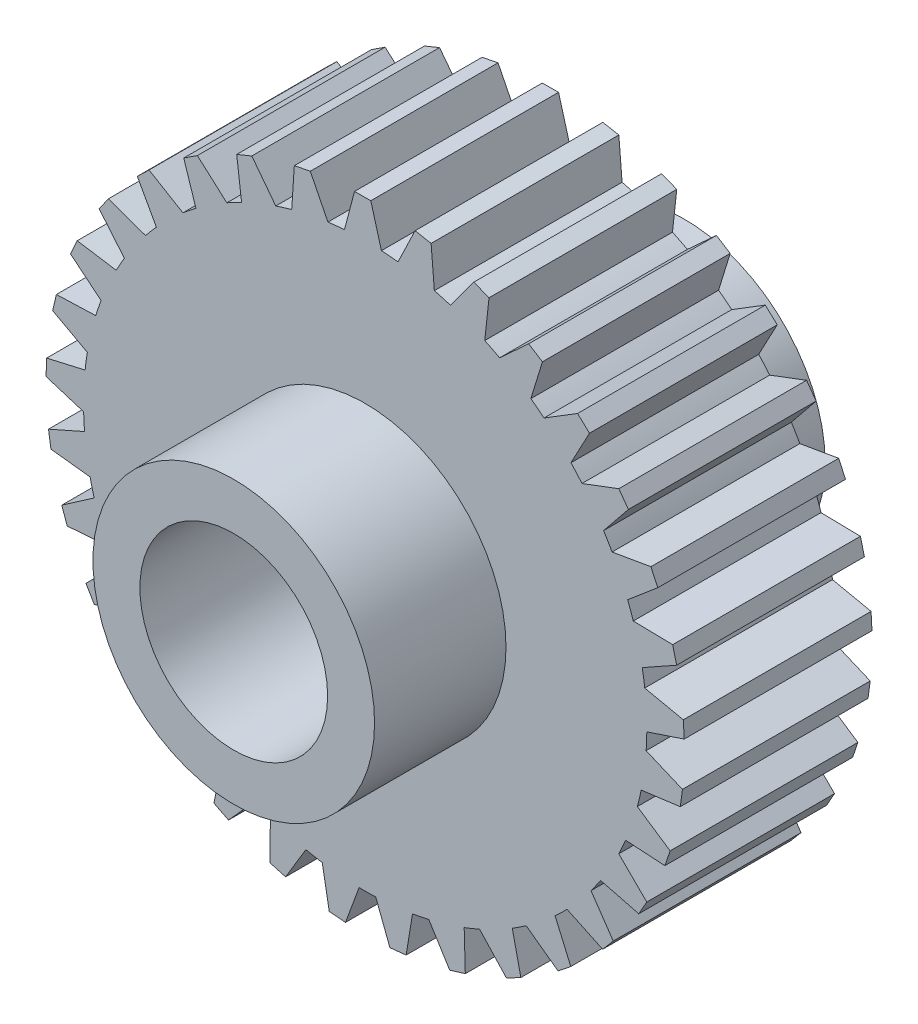
from build123d import *

# Parameters (mm, degrees)
BOSS_EXTRUDE1_DEPTH     = 5
SKETCH2_R               = 7.5
BOSS_EXTRUDE2_DEPTH     = 7
CUT_EXTRUDE1_DEPTH      = 34.968406825
CUT_EXTRUDE1_DEPTH_BACK = 34.968406825
SKETCH3_R               = 5


with BuildPart() as part:
    # Sketch1 → Boss-Extrude1 (new, symmetric)
    with BuildSketch(Plane.XY):
        with BuildLine():
            Line((-0.56896822, 16.990476013), (-1.102638188, 14.959418071))
            ThreePointArc((-1.102638188, 14.959418071), (-1.544192393, 14.920303946), (-1.984398002, 14.868159421))
            Line((-1.984398002, 14.868159421), (-2.92271381, 16.746872663))
            Line((-2.92271381, 16.746872663), (-3.774154951, 16.575758034))
            Line((-3.774154951, 16.575758034), (-3.913800564, 14.480406249))
            ThreePointArc((-3.913800564, 14.480406249), (-4.339972912, 14.358434285), (-4.762355017, 14.22392262))
            Line((-4.762355017, 14.22392262), (-6.039263054, 15.891107632))
            Line((-6.039263054, 15.891107632), (-6.842933888, 15.561948972))
            Line((-6.842933888, 15.561948972), (-6.583507991, 13.478034817))
            ThreePointArc((-6.583507991, 13.478034817), (-6.978895504, 13.277613398), (-7.368188113, 13.065596195))
            Line((-7.368188113, 13.065596195), (-8.937537597, 14.460996567))
            Line((-8.937537597, 14.460996567), (-9.664391366, 13.985690527))
            Line((-9.664391366, 13.985690527), (-9.015270286, 11.98853209))
            ThreePointArc((-9.015270286, 11.98853209), (-9.365582628, 11.716904968), (-9.707715693, 11.435045082))
            Line((-9.707715693, 11.435045082), (-11.512786244, 12.508227408))
            Line((-11.512786244, 12.508227408), (-12.136552559, 11.903952788))
            Line((-12.136552559, 11.903952788), (-11.121197223, 10.065732577))
            ThreePointArc((-11.121197223, 10.065732577), (-11.413773194, 9.732717065), (-11.696381135, 9.391201645))
            Line((-11.696381135, 9.391201645), (-13.6719328, 10.103378321))
            Line((-13.6719328, 10.103378321), (-14.170067122, 9.391975179))
            Line((-14.170067122, 9.391975179), (-12.825175117, 7.779131264))
            ThreePointArc((-12.825175117, 7.779131264), (-13.049440259, 7.396763409), (-13.262308888, 7.007935713))
            Line((-13.262308888, 7.007935713), (-15.336940083, 7.333366818))
            Line((-15.336940083, 7.333366818), (-15.691438539, 6.540547117))
            Line((-15.691438539, 6.540547117), (-14.065617767, 5.211371877))
            ThreePointArc((-14.065617767, 5.211371877), (-14.213466553, 4.793471451), (-14.348902243, 4.371384725))
            Line((-14.348902243, 4.371384725), (-16.447630392, 4.29830833))
            Line((-16.447630392, 4.29830833), (-16.645680483, 3.45272664))
            Line((-16.645680483, 3.45272664), (-14.797692342, 2.455259933))
            ThreePointArc((-14.797692342, 2.455259933), (-14.863781133, 2.016930945), (-14.916888886, 1.576840503))
            Line((-14.916888886, 1.576840503), (-16.963860484, 1.107897781))
            Line((-16.963860484, 1.107897781), (-16.998304165, 0.240115627))
            Line((-16.998304165, 0.240115627), (-14.994939762, -0.389591502))
            ThreePointArc((-14.994939762, -0.389591502), (-14.976879935, -0.8325067), (-14.945740298, -1.274694842))
            Line((-14.945740298, -1.274694842), (-16.866972459, -2.122555081))
            Line((-16.866972459, -2.122555081), (-16.736564846, -2.98117379))
            Line((-16.736564846, -2.98117379), (-14.650230989, -3.220362085))
            ThreePointArc((-14.650230989, -3.220362085), (-14.548675275, -3.651855384), (-14.434413716, -4.080159395))
            Line((-14.434413716, -4.080159395), (-16.160468103, -5.276293272))
            Line((-16.160468103, -5.276293272), (-15.869922466, -6.094715819))
            Line((-15.869922466, -6.094715819), (-13.776024698, -5.934740391))
            ThreePointArc((-13.776024698, -5.934740391), (-13.594643584, -6.339216499), (-13.401389813, -6.738156357))
            Line((-13.401389813, -6.738156357), (-14.869882324, -8.239332477))
            Line((-14.869882324, -8.239332477), (-14.42969974, -8.987978939))
            Line((-14.42969974, -8.987978939), (-12.403916981, -8.434621718))
            ThreePointArc((-12.403916981, -8.434621718), (-12.149266054, -8.797461813), (-11.884004765, -9.152618792))
            Line((-11.884004765, -9.152618792), (-13.041860255, -10.904580739))
            Line((-13.041860255, -10.904580739), (-12.467950069, -11.556393082))
            Line((-12.467950069, -11.556393082), (-10.583499387, -10.629653839))
            ThreePointArc((-10.583499387, -10.629653839), (-10.264782393, -10.937743936), (-9.937100822, -11.236281736))
            Line((-9.937100822, -11.236281736), (-10.742471376, -13.175709041))
            Line((-10.742471376, -13.175709041), (-10.055576198, -13.70712907))
            Line((-10.055576198, -13.70712907), (-8.380566549, -12.440502575))
            ThreePointArc((-8.380566549, -12.440502575), (-8.009302753, -12.682707496), (-7.631044164, -12.913836183))
            Line((-7.631044164, -12.913836183), (-8.054821592, -14.97063289))
            Line((-8.054821592, -14.97063289), (-7.279767603, -15.362453699))
            Line((-7.279767603, -15.362453699), (-5.874738201, -13.801719134))
            ThreePointArc((-5.874738201, -13.801719134), (-5.464346042, -13.969284961), (-5.049181687, -14.124650944))
            Line((-5.049181687, -14.124650944), (-5.07604957, -16.22447906))
            Line((-5.07604957, -16.22447906), (-4.24084924, -16.462539225))
            Line((-4.24084924, -16.462539225), (-3.156581508, -14.664105605))
            ThreePointArc((-3.156581508, -14.664105605), (-2.721893629, -14.750976072), (-2.284828629, -14.824964018))
            Line((-2.284828629, -14.824964018), (-1.91381589, -16.891930285))
            Line((-1.91381589, -16.891930285), (-1.048655536, -16.96762569))
            Line((-1.048655536, -16.96762569), (-0.324337735, -14.996493091))
            ThreePointArc((-0.324337735, -14.996493091), (0.118935112, -14.999528474), (0.562104089, -14.989464266))
            Line((0.562104089, -14.989464266), (1.317588082, -16.948863137))
            Line((1.317588082, -16.948863137), (2.181439312, -16.859457955))
            Line((2.181439312, -16.859457955), (2.519628449, -14.786868244))
            ThreePointArc((2.519628449, -14.786868244), (2.955465228, -14.705958836), (3.3887209, -14.612206222))
            Line((3.3887209, -14.612206222), (4.501370988, -16.393219916))
            Line((4.501370988, -16.393219916), (5.332691259, -16.141945482))
            Line((5.332691259, -16.141945482), (5.272528696, -14.042807453))
            ThreePointArc((5.272528696, -14.042807453), (5.68517713, -13.88087753), (6.092860509, -13.706824972))
            Line((6.092860509, -13.706824972), (7.522462619, -15.245083015))
            Line((7.522462619, -15.245083015), (8.291205849, -14.841021042))
            Line((8.291205849, -14.841021042), (7.834866018, -12.791203011))
            ThreePointArc((7.834866018, -12.791203011), (8.209411919, -12.554105143), (8.576788264, -12.306043355))
            Line((8.576788264, -12.306043355), (10.271672851, -13.545949094))
            Line((10.271672851, -13.545949094), (10.950054658, -13.003703433))
            Line((10.950054658, -13.003703433), (10.114030869, -11.077291166))
            ThreePointArc((10.114030869, -11.077291166), (10.436937171, -10.773594688), (10.750728545, -10.460489269))
            Line((10.750728545, -10.460489269), (12.649638063, -11.357229278))
            Line((12.649638063, -11.357229278), (13.213139961, -10.696398102))
            Line((13.213139961, -10.696398102), (12.027648293, -8.963017156))
            ThreePointArc((12.027648293, -8.963017156), (12.28724432, -8.60369845), (12.536109486, -8.236865845))
            Line((12.536109486, -8.236865845), (14.570412397, -8.758029606))
            Line((14.570412397, -8.758029606), (14.99866796, -8.002497074))
            Line((14.99866796, -8.002497074), (13.506555169, -6.524796354))
            ThreePointArc((13.506555169, -6.524796354), (13.693458446, -6.122842133), (13.868402767, -5.715540629))
            Line((13.868402767, -5.715540629), (15.964574065, -5.842291924))
            Line((15.964574065, -5.842291924), (16.24210502, -5.019364952))
            Line((16.24210502, -5.019364952), (14.497299951, -3.85075241))
            ThreePointArc((14.497299951, -3.85075241), (14.604755306, -3.420690349), (14.699455839, -2.987640883))
            Line((14.699455839, -2.987640883), (16.78173443, -2.715398591))
            Line((16.78173443, -2.715398591), (16.898510086, -1.854819902))
            Line((16.898510086, -1.854819902), (14.96407454, -1.037532242))
            ThreePointArc((14.96407454, -1.037532242), (14.988198256, -0.594905903), (14.999232277, -0.151760012))
            Line((14.999232277, -0.151760012), (16.992359189, 0.509636323))
            Line((16.992359189, 0.509636323), (16.944158969, 1.376763172))
            Line((16.944158969, 1.376763172), (14.890008487, 1.813187044))
            ThreePointArc((14.890008487, 1.813187044), (14.82992867, 2.252379993), (14.756897381, 2.689605862))
            Line((14.756897381, 2.689605862), (16.588835814, 3.716251652))
            Line((16.588835814, 3.716251652), (16.377401799, 4.558586437))
            Line((16.377401799, 4.558586437), (14.277778731, 4.598373027))
            ThreePointArc((14.277778731, 4.598373027), (14.135666823, 5.018259007), (13.981209764, 5.433762373))
            Line((13.981209764, 5.433762373), (15.58574869, 6.788551963))
            Line((15.58574869, 6.788551963), (15.218722658, 7.575650511))
            Line((15.218722658, 7.575650511), (13.149512852, 7.217361828))
            ThreePointArc((13.149512852, 7.217361828), (12.930505147, 7.602765065), (12.7002048, 7.981528553))
            Line((12.7002048, 7.981528553), (14.019352001, 9.61549632))
            Line((14.019352001, 9.61549632), (13.509999227, 10.318910838))
            Line((13.509999227, 10.318910838), (11.545989318, 9.575496367))
            ThreePointArc((11.545989318, 9.575496367), (11.258001325, 9.912487385), (10.960181343, 10.240821497))
            Line((10.960181343, 10.240821497), (11.946259403, 12.094911586))
            Line((11.946259403, 12.094911586), (11.312989225, 12.689218841))
            Line((11.312989225, 12.689218841), (9.525163646, 11.587547519))
            ThreePointArc((9.525163646, 11.587547519), (9.178604003, 11.863946585), (8.824028377, 12.129984469))
            Line((8.824028377, 12.129984469), (9.441397865, 14.137185235))
            Line((9.441397865, 14.137185235), (8.707098316, 14.600905414))
            Line((8.707098316, 14.600905414), (7.160073744, 13.180794513))
            ThreePointArc((7.160073744, 13.180794513), (6.767468017, 13.386611843), (6.368952034, 13.580738198))
            Line((6.368952034, 13.580738198), (6.595299608, 15.668504175))
            Line((6.595299608, 15.668504175), (5.786510188, 15.984877223))
            Line((5.786510188, 15.984877223), (4.53620012, 14.29765325))
            ThreePointArc((4.53620012, 14.29765325), (4.111738104, 14.425450071), (3.68368517, 14.540648664))
            Line((3.68368517, 14.540648664), (3.51083004, 16.63352255))
            Line((3.51083004, 16.63352255), (2.656782505, 16.791113921))
            Line((2.656782505, 16.791113921), (1.748376405, 14.897757548))
            ThreePointArc((1.748376405, 14.897757548), (1.307399264, 14.942914949), (0.865280327, 14.975022202))
            Line((0.865280327, 14.975022202), (0.299469927, 16.997362082))
            Line((0.299469927, 16.997362082), (-0.56896822, 16.990476013))
        make_face()
    extrude(amount=BOSS_EXTRUDE1_DEPTH, both=True)

    # Sketch2 → Boss-Extrude2 (add)
    with BuildSketch(Plane.XY.offset(5)):
        Circle(SKETCH2_R)
    boss_extrude2 = extrude(amount=BOSS_EXTRUDE2_DEPTH)

    # Mirror1: Boss-Extrude2 across plane
    add(boss_extrude2.mirror(Plane.XY))

    # Sketch3 → Cut-Extrude1 (cut, two sides: drawn at the far end of the back side and taken through both)
    with BuildSketch(Plane.XY.offset(12).offset(-CUT_EXTRUDE1_DEPTH_BACK)):
        Circle(SKETCH3_R)
    extrude(amount=CUT_EXTRUDE1_DEPTH + CUT_EXTRUDE1_DEPTH_BACK, mode=Mode.SUBTRACT)


solid = part.part
